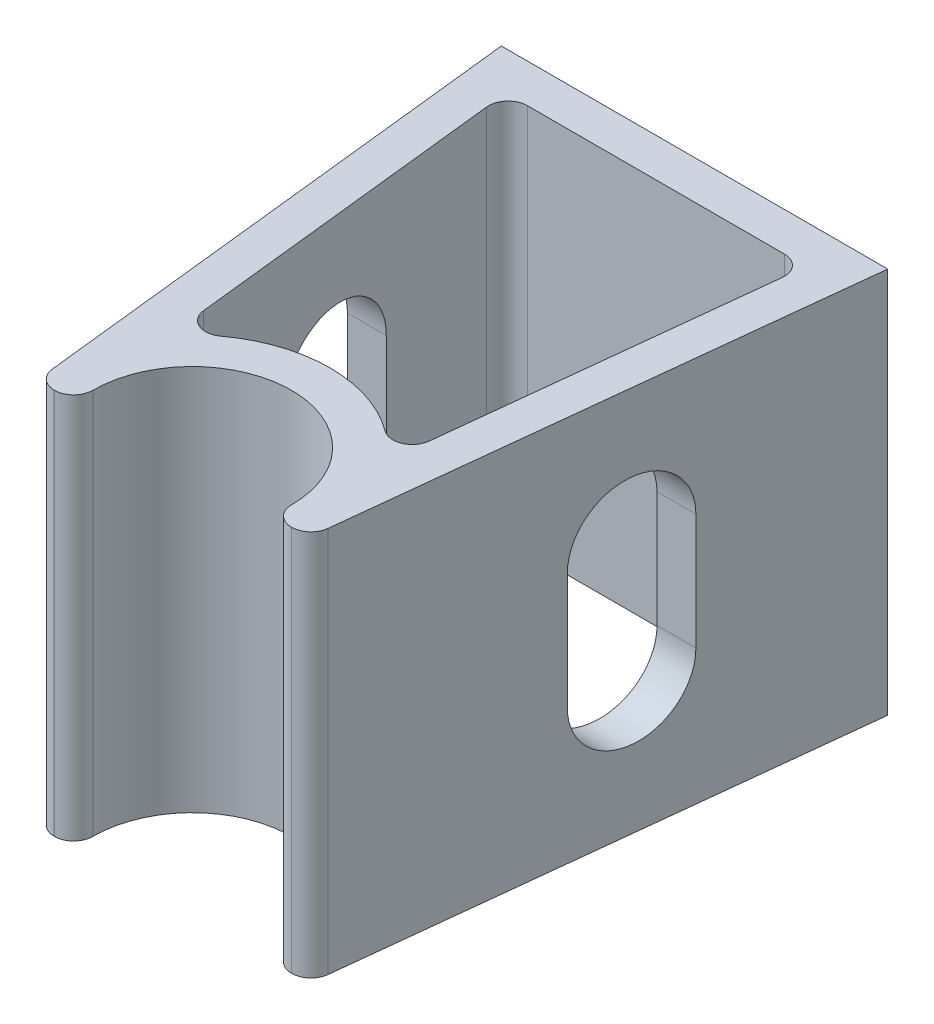
from build123d import *

# Parameters (mm, degrees)
BOSS_EXTRUDE1_DEPTH     = 50
CUT_EXTRUDE1_DEPTH      = 86.732140997
CUT_EXTRUDE1_DEPTH_BACK = 86.732140997
FILLET2_R               = 2.5
CUT_EXTRUDE2_DEPTH      = 86.732140997
CUT_EXTRUDE2_DEPTH_BACK = 86.732140997
SKETCH4_W               = 0.314102564
SKETCH4_H               = 3.58974359
BOSS_EXTRUDE2_DEPTH     = 1


with BuildPart() as part:
    # Sketch1 → Boss-Extrude1 (new body)
    with BuildSketch(Plane(origin=(0, 0, 0), x_dir=(1, 0, 0), z_dir=(0, 1, 0))):
        with BuildLine():
            Line((-12.6, -2.5), (-17.6, -2.5))
            Line((-17.6, -2.5), (-25, 65))
            Line((-25, 65), (25, 65))
            Line((25, 65), (17.6, -2.5))
            Line((17.6, -2.5), (12.6, -2.5))
            ThreePointArc((12.6, -2.5), (0, 12.845621822), (-12.6, -2.5))
        make_face()
    extrude(amount=BOSS_EXTRUDE1_DEPTH)

    # Sketch2 → Cut-Extrude1 (cut, two sides: drawn at the far end of the back side and taken through both)
    with BuildSketch(Plane(origin=(0, 50, 0), x_dir=(1, 0, 0), z_dir=(0, 1, 0)).offset(-CUT_EXTRUDE1_DEPTH_BACK)):
        with BuildLine():
            Line((14.050316299, 11.002491996), (19.421894954, 60))
            Line((19.421894954, 60), (-19.421894954, 60))
            Line((-19.421894954, 60), (-14.050316299, 11.002491996))
            ThreePointArc((-14.050316299, 11.002491996), (0, 17.845621822), (14.050316299, 11.002491996))
        make_face()
    extrude(amount=CUT_EXTRUDE1_DEPTH + CUT_EXTRUDE1_DEPTH_BACK, mode=Mode.SUBTRACT)

    # Fillet2
    fillet2_edges = [part.edges().sort_by_distance(p)[0] for p in [
        (-19.421894954, 25, -60),
        (19.421894954, 25, -60),
        (14.050316299, 25, -11.002491996),
        (-14.050316299, 25, -11.002491996),
        (17.6, 25, 2.5),
        (12.6, 25, 2.5),
        (-17.6, 25, 2.5),
        (-12.6, 25, 2.5),
    ]]
    fillet(fillet2_edges, radius=FILLET2_R)

    # Sketch3 → Cut-Extrude2 (cut, two sides: drawn at the far end of the back side and taken through both)
    with BuildSketch(Plane(origin=(0, 0, 0), x_dir=(0, 0, -1), z_dir=(1, 0, 0)).offset(-CUT_EXTRUDE2_DEPTH_BACK)):
        with BuildLine():
            Line((42.627558228, 32.5), (42.627558228, 17.5))
            ThreePointArc((42.627558228, 17.5), (35.127558228, 10), (27.627558228, 17.5))
            Line((27.627558228, 17.5), (27.627558228, 32.5))
            ThreePointArc((27.627558228, 32.5), (35.127558228, 40), (42.627558228, 32.5))
        make_face()
    extrude(amount=CUT_EXTRUDE2_DEPTH + CUT_EXTRUDE2_DEPTH_BACK, mode=Mode.SUBTRACT)

    # Sketch4 → Boss-Extrude2 (add)
    # profile 1 of 4: a face of its own
    with BuildSketch(Plane(origin=(0, 0, -65), x_dir=(-1, 0, 0), z_dir=(0, 0, -1))):
        with Locations((-5.237076889, 31.145469274)):
            Rectangle(SKETCH4_W, SKETCH4_H)
    # profile 2 of 4: a face of its own
    with BuildSketch(Plane(origin=(0, 0, -65), x_dir=(-1, 0, 0), z_dir=(0, 0, -1))):
        with BuildLine():
            Line((-4.406948684, 31.908289787), (-4.09284612, 31.908289787))
            Line((-4.09284612, 31.908289787), (-4.09284612, 30.72199171))
            add(Edge.make_bspline(
                [(-4.09284612, 30.72199171), (-4.092704215, 30.687168961), (-4.092432757, 30.620554673), (-4.090591816, 30.524699486), (-4.086261723, 30.437282773), (-4.080847898, 30.358254037), (-4.073885762, 30.287626645), (-4.065602402, 30.225647288), (-4.05634398, 30.171613104), (-4.047281266, 30.139069748), (-4.043066472, 30.123934819)],
                knots=[0, 0, 0, 0, 1.388932606, 2.656963016, 3.823490214, 4.879454478, 5.816252168, 6.653371382, 7.373723809, 8, 8, 8, 8], degree=3))
            add(Edge.make_bspline(
                [(-4.043066472, 30.123934819), (-4.036305017, 30.104911948), (-4.022922676, 30.067261687), (-3.998649193, 30.012872682), (-3.968620856, 29.962497399), (-3.935761028, 29.914193327), (-3.89786162, 29.86939134), (-3.855402149, 29.828167096), (-3.809803912, 29.788963005), (-3.742048889, 29.742578213), (-3.649389623, 29.692862883), (-3.527736868, 29.649967064), (-3.395832642, 29.624331244), (-3.304667922, 29.621356989), (-3.257810062, 29.619828248)],
                knots=[0, 0, 0, 0, 0.725840625, 1.436591201, 2.137033971, 2.831655856, 3.53531722, 4.242432219, 4.957935707, 5.694543706, 7.190802206, 8.724350549, 10.316345118, 12, 12, 12, 12], degree=3))
            add(Edge.make_bspline(
                [(-3.257810062, 29.619828248), (-3.210956554, 29.621389497), (-3.120303686, 29.624410224), (-2.989848717, 29.649193763), (-2.870597302, 29.690599452), (-2.763746351, 29.748406864), (-2.669780511, 29.819148926), (-2.591476092, 29.902157735), (-2.526868838, 29.994807122), (-2.498659417, 30.063931401), (-2.484472722, 30.098694434)],
                knots=[0, 0, 0, 0, 1.157059328, 2.238695713, 3.266970494, 4.264342957, 5.228770407, 6.160125903, 7.074715775, 8, 8, 8, 8], degree=3))
            add(Edge.make_bspline(
                [(-2.484472722, 30.098694434), (-2.480278492, 30.112660733), (-2.471006074, 30.143536808), (-2.461043722, 30.195916557), (-2.452069261, 30.258381161), (-2.444406085, 30.33133937), (-2.438940922, 30.414600522), (-2.435994895, 30.508138599), (-2.43266662, 30.611659959), (-2.432616104, 30.684127718), (-2.432589709, 30.72199171)],
                knots=[0, 0, 0, 0, 0.557542046, 1.232589297, 2.036731608, 2.971723315, 4.038036528, 5.22795436, 6.551621927, 8, 8, 8, 8], degree=3))
            Line((-2.432589709, 30.72199171), (-2.432589709, 31.908289787))
            Line((-2.432589709, 31.908289787), (-2.118487145, 31.908289787))
            Line((-2.118487145, 31.908289787), (-2.118487145, 30.663097479))
            add(Edge.make_bspline(
                [(-2.118487145, 30.663097479), (-2.11892884, 30.620790308), (-2.119785789, 30.538708608), (-2.125293132, 30.419424496), (-2.134742745, 30.308262251), (-2.14908543, 30.205163032), (-2.165951104, 30.11020555), (-2.187707377, 30.023268104), (-2.213685615, 29.94461855), (-2.24299113, 29.872876773), (-2.277612998, 29.807829879), (-2.314440018, 29.746094062), (-2.35696479, 29.689201127), (-2.401735024, 29.63431899), (-2.45153668, 29.584177462), (-2.505436539, 29.537625987), (-2.562675959, 29.493952955), (-2.624525157, 29.454861675), (-2.69008122, 29.41964503), (-2.759425077, 29.388428952), (-2.833406075, 29.363726375), (-2.911069712, 29.342415709), (-2.992796491, 29.32570124), (-3.078507624, 29.313914673), (-3.168174241, 29.306689342), (-3.2292837, 29.306052298), (-3.260614549, 29.305725684)],
                knots=[0, 0, 0, 0, 1.493040784, 2.896703357, 4.213163133, 5.428574705, 6.569057535, 7.615249723, 8.588095153, 9.490268104, 10.346124644, 11.18633936, 12.024365274, 12.850166724, 13.684164916, 14.514361689, 15.362232829, 16.222528818, 17.093394965, 17.986930858, 18.902426812, 19.842810585, 20.827885679, 21.843828298, 22.894529745, 24, 24, 24, 24], degree=3))
            add(Edge.make_bspline(
                [(-3.260614549, 29.305725684), (-3.291711063, 29.306065391), (-3.352818608, 29.306732948), (-3.442489853, 29.313874755), (-3.528438459, 29.325682926), (-3.610358857, 29.342538143), (-3.688333255, 29.363577213), (-3.762677495, 29.388580749), (-3.832521058, 29.419661231), (-3.898703062, 29.454638788), (-3.96070545, 29.494204063), (-4.018814028, 29.537572103), (-4.072950881, 29.584678166), (-4.123127949, 29.635325523), (-4.168640925, 29.69014246), (-4.210056967, 29.74868802), (-4.248013672, 29.810382109), (-4.282366462, 29.876445271), (-4.311878218, 29.949017281), (-4.337933464, 30.029314378), (-4.359244102, 30.118216895), (-4.37658657, 30.215648823), (-4.390538011, 30.321143865), (-4.400224153, 30.43531228), (-4.405639984, 30.557875972), (-4.406503045, 30.642525862), (-4.406948684, 30.686234498)],
                knots=[0, 0, 0, 0, 1.083640291, 2.129454052, 3.13281866, 4.105697902, 5.042300162, 5.946461698, 6.836384745, 7.703652036, 8.553297018, 9.397182691, 10.228592656, 11.052265423, 11.879314572, 12.708807002, 13.549817954, 14.402308542, 15.300838682, 16.27712199, 17.341985831, 18.484375296, 19.725102775, 21.0496083, 22.476576903, 24, 24, 24, 24], degree=3))
            Line((-4.406948684, 30.686234498), (-4.406948684, 31.908289787))
        make_face()
    # profile 3 of 4: a face of its own
    with BuildSketch(Plane(origin=(0, 0, -65), x_dir=(-1, 0, 0), z_dir=(0, 0, -1))):
        Polygon((-1.400538427, 32.940341069), (-1.086435863, 32.940341069), (-1.086435863, 30.865020556), (0.078127438, 31.908289787), (0.528948752, 31.908289787), (-0.821411825, 30.696751325), (0.663564137, 29.350597479), (0.212742823, 29.350597479), (-1.086435863, 30.529183216), (-1.086435863, 29.350597479), (-1.400538427, 29.350597479), align=None)
    # profile 4 of 4: a face of its own
    with BuildSketch(Plane(origin=(0, 0, -65), x_dir=(-1, 0, 0), z_dir=(0, 0, -1))):
        with BuildLine():
            Line((3.121697149, 30.158289787), (3.400743624, 30.011755332))
            add(Edge.make_bspline(
                [(3.400743624, 30.011755332), (3.378507029, 29.972312001), (3.33524342, 29.895570898), (3.260842672, 29.790139037), (3.1828506, 29.695291321), (3.097746632, 29.613561667), (3.008076953, 29.542310282), (2.913344298, 29.479972457), (2.81305548, 29.426853937), (2.707205755, 29.382101409), (2.594906204, 29.347691915), (2.475884688, 29.323387694), (2.349913192, 29.308364425), (2.263567013, 29.306619285), (2.219353399, 29.305725684)],
                knots=[0, 0, 0, 0, 1.120438281, 2.179929193, 3.190490725, 4.156257408, 5.095198341, 6.022838206, 6.959905092, 7.901321166, 8.864066838, 9.862729781, 10.905609505, 12, 12, 12, 12], degree=3))
            add(Edge.make_bspline(
                [(2.219353399, 29.305725684), (2.170211422, 29.30687286), (2.07434966, 29.309110666), (1.934809913, 29.328403131), (1.803430495, 29.35987549), (1.680218791, 29.403841031), (1.565476539, 29.461268355), (1.458975684, 29.531227837), (1.360156158, 29.613360092), (1.272131949, 29.708376535), (1.192888066, 29.810058492), (1.122962246, 29.916014377), (1.064504815, 30.025977601), (1.016952205, 30.139248125), (0.97854734, 30.255112019), (0.951780636, 30.374623486), (0.936350888, 30.497459071), (0.933986443, 30.580556406), (0.932794906, 30.622432415)],
                knots=[0, 0, 0, 0, 1.145258523, 2.234067595, 3.276747158, 4.290159414, 5.277019952, 6.260822364, 7.254936242, 8.264827045, 9.274100331, 10.257902744, 11.220704747, 12.172965371, 13.118907548, 14.062713208, 15.023725156, 16, 16, 16, 16], degree=3))
            add(Edge.make_bspline(
                [(0.932794906, 30.622432415), (0.933854047, 30.661727246), (0.935953125, 30.73960441), (0.949183913, 30.854869955), (0.972632206, 30.966898407), (1.00480853, 31.075782855), (1.046359776, 31.181340989), (1.097191995, 31.283637053), (1.157384373, 31.382562193), (1.203857047, 31.444965326), (1.22726606, 31.476398761)],
                knots=[0, 0, 0, 0, 1.024358464, 2.0301432, 3.019427413, 4.004406732, 4.986367066, 5.972626655, 6.978780325, 8, 8, 8, 8], degree=3))
            add(Edge.make_bspline(
                [(1.22726606, 31.476398761), (1.258973743, 31.514267631), (1.321384689, 31.588805782), (1.426941044, 31.686744108), (1.541241241, 31.768787883), (1.662852867, 31.836795019), (1.793189341, 31.888468666), (1.930498632, 31.926976248), (2.076344218, 31.948554259), (2.176049439, 31.951602093), (2.227065739, 31.953161582)],
                knots=[0, 0, 0, 0, 1.030682036, 2.02871468, 2.997146059, 3.962720338, 4.930598197, 5.918074684, 6.934738563, 8, 8, 8, 8], degree=3))
            add(Edge.make_bspline(
                [(2.227065739, 31.953161582), (2.279513345, 31.951807533), (2.38240359, 31.949151198), (2.532435712, 31.924524864), (2.674396428, 31.88547231), (2.808228932, 31.830318519), (2.933946793, 31.759158967), (3.050732843, 31.671017126), (3.160584355, 31.568599039), (3.224492934, 31.489835829), (3.257013656, 31.449756133)],
                knots=[0, 0, 0, 0, 1.056321875, 2.072262726, 3.055038591, 4.01806755, 4.982017516, 5.957941055, 6.960871419, 8, 8, 8, 8], degree=3))
            add(Edge.make_bspline(
                [(3.257013656, 31.449756133), (3.279140594, 31.419552552), (3.323247187, 31.359346433), (3.378494287, 31.261175276), (3.426451682, 31.158464682), (3.464784643, 31.049554384), (3.495824145, 30.935734804), (3.518280963, 30.81619226), (3.531450582, 30.690962348), (3.534039279, 30.605635793), (3.535359008, 30.562135941)],
                knots=[0, 0, 0, 0, 0.94817472, 1.890038105, 2.849395472, 3.817997239, 4.812318967, 5.836947057, 6.897266129, 8, 8, 8, 8], degree=3))
            Line((3.535359008, 30.562135941), (1.24689747, 30.562135941))
            add(Edge.make_bspline(
                [(1.24689747, 30.562135941), (1.248437076, 30.528435477), (1.25146465, 30.462164873), (1.265579794, 30.36519409), (1.287828567, 30.272820748), (1.31909763, 30.185737706), (1.356964475, 30.102807578), (1.403350192, 30.024645541), (1.458689746, 29.951607611), (1.520415445, 29.883040473), (1.589122541, 29.821979712), (1.661405288, 29.767327936), (1.738298853, 29.721522339), (1.819196936, 29.68434245), (1.903968722, 29.655236133), (1.992640917, 29.635368313), (2.085039033, 29.622061206), (2.148024767, 29.620581541), (2.180090579, 29.619828248)],
                knots=[0, 0, 0, 0, 1.094153842, 2.151609401, 3.174256925, 4.172055639, 5.149267565, 6.128595816, 7.11444997, 8.118368179, 9.117203808, 10.09244225, 11.054858984, 12.015122123, 12.976791628, 13.957293641, 14.960065497, 16, 16, 16, 16], degree=3))
            add(Edge.make_bspline(
                [(2.180090579, 29.619828248), (2.211441727, 29.620436305), (2.273648417, 29.621642806), (2.366289275, 29.633374717), (2.457428802, 29.652344993), (2.546689786, 29.678234983), (2.632260631, 29.709811835), (2.711506181, 29.747914693), (2.784386397, 29.790064439), (2.852503364, 29.838274114), (2.918574357, 29.897282301), (2.984116843, 29.970918022), (3.054393497, 30.05800555), (3.09838309, 30.123551216), (3.121697149, 30.158289787)],
                knots=[0, 0, 0, 0, 0.99110716, 1.966546729, 2.947904876, 3.932708344, 4.903319531, 5.828989031, 6.710028674, 7.56322171, 8.463672341, 9.504779593, 10.677557249, 12, 12, 12, 12], degree=3))
        make_face()
        with BuildLine():
            add(Edge.make_bspline(
                [(3.221256444, 30.876238505), (3.20975982, 30.917901379), (3.187632518, 30.998088999), (3.141396154, 31.10912989), (3.089324613, 31.207817791), (3.027702882, 31.293397424), (2.957884156, 31.369400937), (2.877238974, 31.435819522), (2.78680308, 31.495236973), (2.687043939, 31.545389472), (2.581402154, 31.588079331), (2.470795962, 31.616704447), (2.357938174, 31.636313989), (2.281603888, 31.638140098), (2.243191541, 31.639059018)],
                knots=[0, 0, 0, 0, 1.154881502, 2.222775134, 3.210006277, 4.132804581, 5.035138423, 5.962687519, 6.919655026, 7.923214229, 8.944639381, 9.960483929, 10.97369054, 12, 12, 12, 12], degree=3))
            add(Edge.make_bspline(
                [(2.243191541, 31.639059018), (2.211842102, 31.638447346), (2.149870853, 31.6372382), (2.058569785, 31.625768071), (1.970890086, 31.606808226), (1.886184798, 31.580843269), (1.80556393, 31.546234667), (1.727369162, 31.50565144), (1.653588765, 31.456109856), (1.60744747, 31.418351002), (1.584137053, 31.399275364)],
                knots=[0, 0, 0, 0, 1.04873581, 2.073130211, 3.073294108, 4.04793562, 5.032784715, 6.005352987, 6.992311501, 8, 8, 8, 8], degree=3))
            add(Edge.make_bspline(
                [(1.584137053, 31.399275364), (1.567443771, 31.384181048), (1.533660637, 31.353633832), (1.488520116, 31.301004626), (1.445299643, 31.244253063), (1.40596599, 31.181207939), (1.369888404, 31.11258716), (1.336128427, 31.038969525), (1.305742014, 30.959796394), (1.288645904, 30.904623955), (1.279850194, 30.876238505)],
                knots=[0, 0, 0, 0, 0.879870761, 1.780643979, 2.707998968, 3.669668524, 4.684282772, 5.740141944, 6.837334558, 8, 8, 8, 8], degree=3))
            Line((1.279850194, 30.876238505), (3.221256444, 30.876238505))
        make_face(mode=Mode.SUBTRACT)
    extrude(amount=BOSS_EXTRUDE2_DEPTH)


solid = part.part
